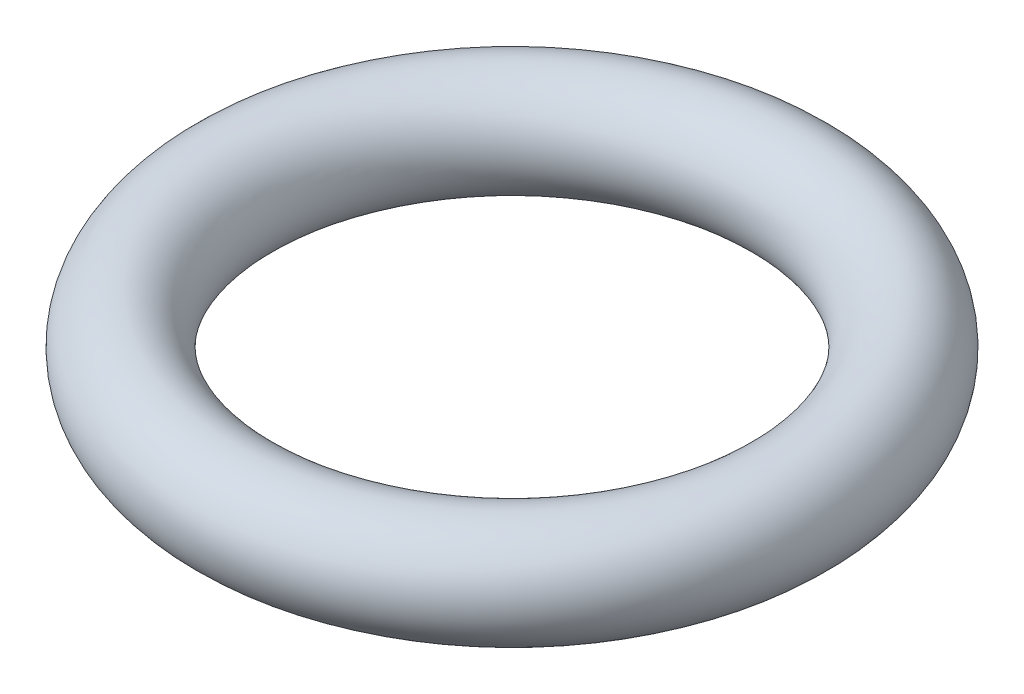
from build123d import *

# Parameters (mm, degrees)
SKETCH1_R = 1


with BuildPart() as part:
    # Sketch1 → Revolve1 (revolve)
    with BuildSketch(Plane.XY):
        with Locations((5.25, 0)):
            Circle(SKETCH1_R)
    revolve(axis=Axis((0, 2, 0), (0, -1, 0)))


solid = part.part
